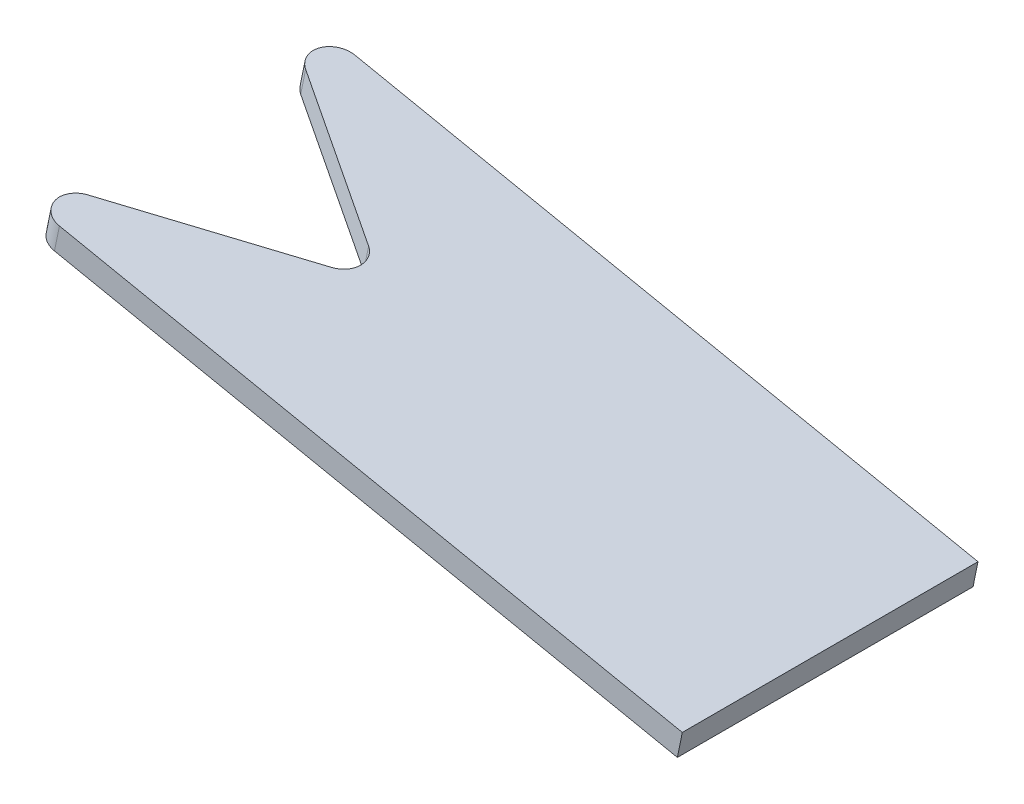
from build123d import *

# Parameters (mm, degrees)
BOSS_EXTRUDE3_DEPTH = 180
CUT_EXTRUDE1_DEPTH  = 180
FILLET1_R           = 13
FILLET2_R           = 13


with BuildPart() as part:
    # Sketch1 → Boss-Extrude3 (new body)
    with BuildSketch(Plane.XY):
        Polygon((0, 0), (-391.918358845, 80), (-388.918358845, 94.696938457), (3, 14.696938457), align=None)
    extrude(amount=BOSS_EXTRUDE3_DEPTH)

    # Sketch4 → Cut-Extrude1 (cut)
    with BuildSketch(Plane(origin=(3, 14.696938457, 0), x_dir=(0.9797958971132712, -0.2, 0), z_dir=(0.2, 0.9797958971132712, 0))):
        Polygon((-400, -20), (-278.75644347, -90), (-400, -160), align=None)
    extrude(amount=-CUT_EXTRUDE1_DEPTH, mode=Mode.SUBTRACT)

    # Fillet1
    # the kernel refuses this fillet: 13 mm, written as the material it takes off along each edge
    with BuildSketch(Plane(origin=(-398.418358845, 48.156633344, 0), x_dir=(0.9797958971132713, -0.19999999999999976, 0), z_dir=(0.19999999999999976, 0.9797958971132713, 0)), Plane(origin=(-398.418358845, 48.156633344, 180), x_dir=(0, 0, -1), z_dir=(0.19999999999999976, 0.9797958971132713, 0))) as fillet1_piece_1:
        with BuildLine():
            CenterArc((FILLET1_R, -FILLET1_R), FILLET1_R, 90, 90)
            Line((0, -FILLET1_R), (0, 0))
            Line((0, 0), (FILLET1_R, 0))
        make_face()
    extrude(amount=80, mode=Mode.SUBTRACT)
    with BuildSketch(Plane(origin=(-385.165582096, 113.081714768, 20), x_dir=(0, 0, -1), z_dir=(-0.20000000000000004, -0.9797958971132713, 0)), Plane(origin=(-385.165582096, 113.081714768, 160), x_dir=(0.8485281374238575, -0.17320508075688784, -0.4999999999999992), z_dir=(-0.20000000000000004, -0.9797958971132713, 0))) as fillet1_piece_2:
        with BuildLine():
            CenterArc((FILLET1_R * 0.57735026919, FILLET1_R), FILLET1_R, 210, 60)
            Line((-FILLET1_R * 0.288675134595, FILLET1_R * 0.5), (0, 0))
            Line((0, 0), (FILLET1_R * 0.57735026919, 0))
        make_face()
    extrude(amount=52.527767497, mode=Mode.SUBTRACT)

    # Fillet2
    fillet2_edges = [part.edges().sort_by_distance(p)[0] for p in [
        (-271.624419606, 63.099757922, 90),
    ]]
    fillet(fillet2_edges, radius=FILLET2_R)


solid = part.part
